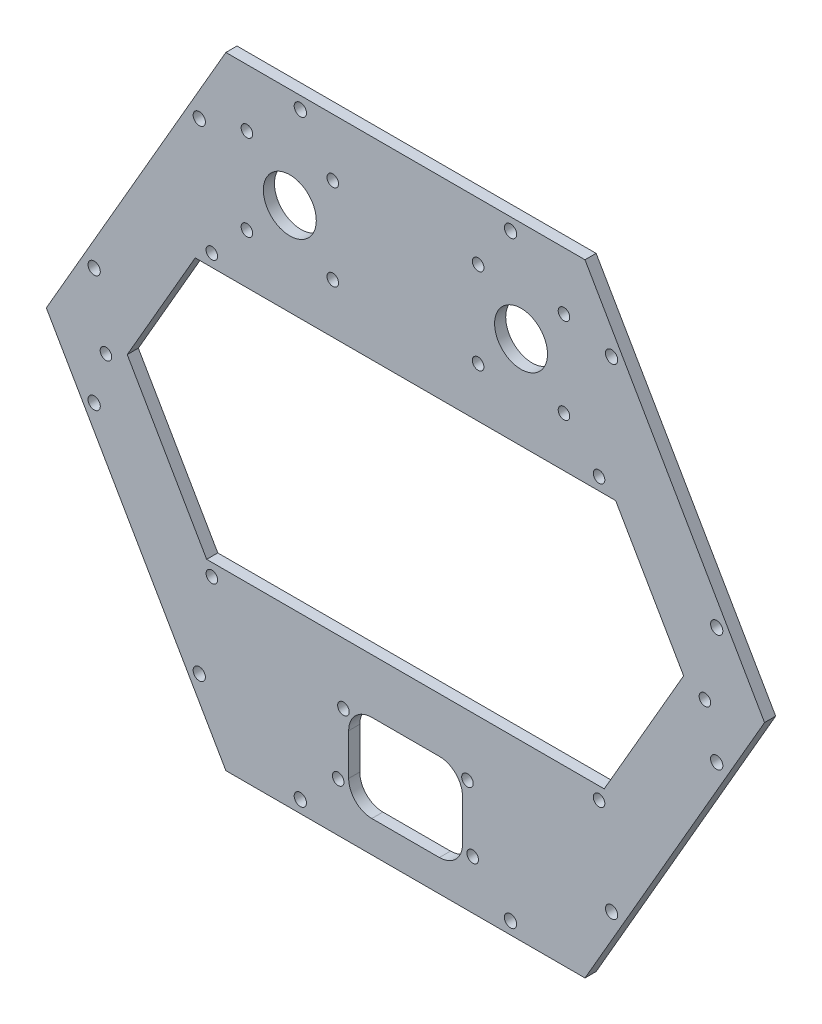
from build123d import *

# Parameters (mm, degrees)
FLANGE_BASE1_DEPTH          = 3.175
ESBO_O6_R                   = 1.65
CORTE_EXTRUS_O1_DEPTH       = 10
ESBO_O7_R                   = 1.75
CORTE_EXTRUS_O2_DEPTH       = 10
ESBO_O8_R                   = 7.554969153
ESBO_O8_R_2                 = 1.65
CORTE_EXTRUS_O3_DEPTH       = 10
PADR_OCIRCULAR1_COUNT       = 4
PADR_OCIRCULAR2_COUNT       = 6
ESPELHAR1_COPY_1_SKETCH_R   = 7.554969153
ESPELHAR1_COPY_1_SKETCH_R_2 = 1.65
ESPELHAR1_COPY_1_DEPTH      = 10
ESPELHAR1_COPY_2_SKETCH_R   = 7.554969153
ESPELHAR1_COPY_2_SKETCH_R_2 = 1.65
ESPELHAR1_COPY_2_DEPTH      = 10
ESPELHAR1_COPY_3_SKETCH_R   = 7.554969153
ESPELHAR1_COPY_3_SKETCH_R_2 = 1.65
ESPELHAR1_COPY_3_DEPTH      = 10
ESBO_O9_R                   = 1.65
CORTE_EXTRUS_O4_DEPTH       = 10


# Sheet-metal steps are written as plain solids
with BuildPart() as part:
    # Esboço1 → Flange-base1 (new body)
    with BuildSketch(Plane.XY):
        Polygon((51.251383396, 88.77), (102.502766792, 0), (51.251383396, -88.77), (-51.251383396, -88.77), (-102.502766792, 0), (-51.251383396, 88.77), align=None)
        Polygon((60, 33.616951546), (-60, 33.616951546), (-79.408756024, 0), (-56.734237399, -39.273418297), (56.734237399, -39.273418297), (79.408756024, 0), align=None, mode=Mode.SUBTRACT)
    extrude(amount=-FLANGE_BASE1_DEPTH)

    # Esboço6 → Corte-extrusão1 (cut)
    with BuildSketch(Plane.XY):
        with BuildLine():
            Line((9.692826752, -79.77), (-9.607173248, -79.77))
            ThreePointArc((-9.607173248, -79.77), (-14.274078004, -77.836904756), (-16.207173248, -73.17))
            Line((-16.207173248, -73.17), (-16.207173248, -61.37))
            ThreePointArc((-16.207173248, -61.37), (-14.274078004, -56.703095244), (-9.607173248, -54.77))
            Line((-9.607173248, -54.77), (9.692826752, -54.77))
            ThreePointArc((9.692826752, -54.77), (14.359731508, -56.703095244), (16.292826752, -61.37))
            Line((16.292826752, -61.37), (16.292826752, -73.17))
            ThreePointArc((16.292826752, -73.17), (14.359731508, -77.836904756), (9.692826752, -79.77))
        make_face()
        with Locations((-17.7, -56.67)):
            Circle(ESBO_O6_R)
        with Locations((17.7, -56.67)):
            Circle(ESBO_O6_R)
        with Locations((19.2, -74.77)):
            Circle(ESBO_O6_R)
        with Locations((-19.2, -74.77)):
            Circle(ESBO_O6_R)
    extrude(amount=-CORTE_EXTRUS_O1_DEPTH, mode=Mode.SUBTRACT)

    # Esboço7 → Corte-extrusão2 (cut)
    with BuildSketch(Plane.XY):
        with Locations((-30, -85.27)):
            Circle(ESBO_O7_R)
        with Locations((30, -85.27)):
            Circle(ESBO_O7_R)
    corte_extrus_o2 = extrude(amount=-CORTE_EXTRUS_O2_DEPTH, mode=Mode.SUBTRACT)

    # Esboço8 → Corte-extrusão3 (cut)
    with BuildSketch(Plane.XY):
        with Locations((-33, 60.0982)):
            Circle(ESBO_O8_R)
        with Locations((-20.75, 47.8482)):
            Circle(ESBO_O8_R_2)
    corte_extrus_o3 = extrude(amount=-CORTE_EXTRUS_O3_DEPTH, mode=Mode.SUBTRACT)

    # PadrãoCircular1: Corte-extrusão3 ×4 about axis
    padr_ocircular1_axis = Axis((-33, 60.0982, 0), (0, 0, 1))
    for i in range(1, PADR_OCIRCULAR1_COUNT):
        add(corte_extrus_o3.rotate(padr_ocircular1_axis, i * 360 / PADR_OCIRCULAR1_COUNT), mode=Mode.SUBTRACT)

    # PadrãoCircular2: Corte-extrusão2 ×6 about axis
    padr_ocircular2_axis = Axis((0, 0, 0), (0, 0, 1))
    for i in range(1, PADR_OCIRCULAR2_COUNT):
        add(corte_extrus_o2.rotate(padr_ocircular2_axis, i * 360 / PADR_OCIRCULAR2_COUNT), mode=Mode.SUBTRACT)

    # Espelhar1: Corte-extrusão3 across plane
    add(corte_extrus_o3.mirror(Plane(origin=(0, 0, 0), x_dir=(0, 0, 1), z_dir=(1, 0, 0))), mode=Mode.SUBTRACT)

    # Espelhar1 copy 1 sketch → Espelhar1 copy 1 (cut)
    with BuildSketch(Plane(origin=(-27.0982, 93.0982, 0), x_dir=(0, 1, 0), z_dir=(0, 0, 1))):
        with Locations((-33, -60.0982)):
            Circle(ESPELHAR1_COPY_1_SKETCH_R)
        with Locations((-20.75, -47.8482)):
            Circle(ESPELHAR1_COPY_1_SKETCH_R_2)
    extrude(amount=-ESPELHAR1_COPY_1_DEPTH, mode=Mode.SUBTRACT)

    # Espelhar1 copy 2 sketch → Espelhar1 copy 2 (cut)
    with BuildSketch(Plane(origin=(66, 120.1964, 0), x_dir=(1, 0, 0), z_dir=(0, 0, 1))):
        with Locations((-33, -60.0982)):
            Circle(ESPELHAR1_COPY_2_SKETCH_R)
        with Locations((-20.75, -47.8482)):
            Circle(ESPELHAR1_COPY_2_SKETCH_R_2)
    extrude(amount=-ESPELHAR1_COPY_2_DEPTH, mode=Mode.SUBTRACT)

    # Espelhar1 copy 3 sketch → Espelhar1 copy 3 (cut)
    with BuildSketch(Plane(origin=(93.0982, 27.0982, 0), x_dir=(0, -1, 0), z_dir=(0, 0, 1))):
        with Locations((-33, -60.0982)):
            Circle(ESPELHAR1_COPY_3_SKETCH_R)
        with Locations((-20.75, -47.8482)):
            Circle(ESPELHAR1_COPY_3_SKETCH_R_2)
    extrude(amount=-ESPELHAR1_COPY_3_DEPTH, mode=Mode.SUBTRACT)

    # Esboço9 → Corte-extrusão4 (cut)
    with BuildSketch(Plane.XY):
        with Locations((-55.257737945, 37.171766625)):
            Circle(ESBO_O9_R)
        with Locations((-85.480762114, -2.828233375)):
            Circle(ESBO_O9_R)
        with Locations((85.480762114, -2.828233375)):
            Circle(ESBO_O9_R)
        with Locations((55.257737945, 37.171766625)):
            Circle(ESBO_O9_R)
        with Locations((55.257737945, -42.828233375)):
            Circle(ESBO_O9_R)
        with Locations((-55.257737945, -42.828233375)):
            Circle(ESBO_O9_R)
    extrude(amount=-CORTE_EXTRUS_O4_DEPTH, mode=Mode.SUBTRACT)


solid = part.part
